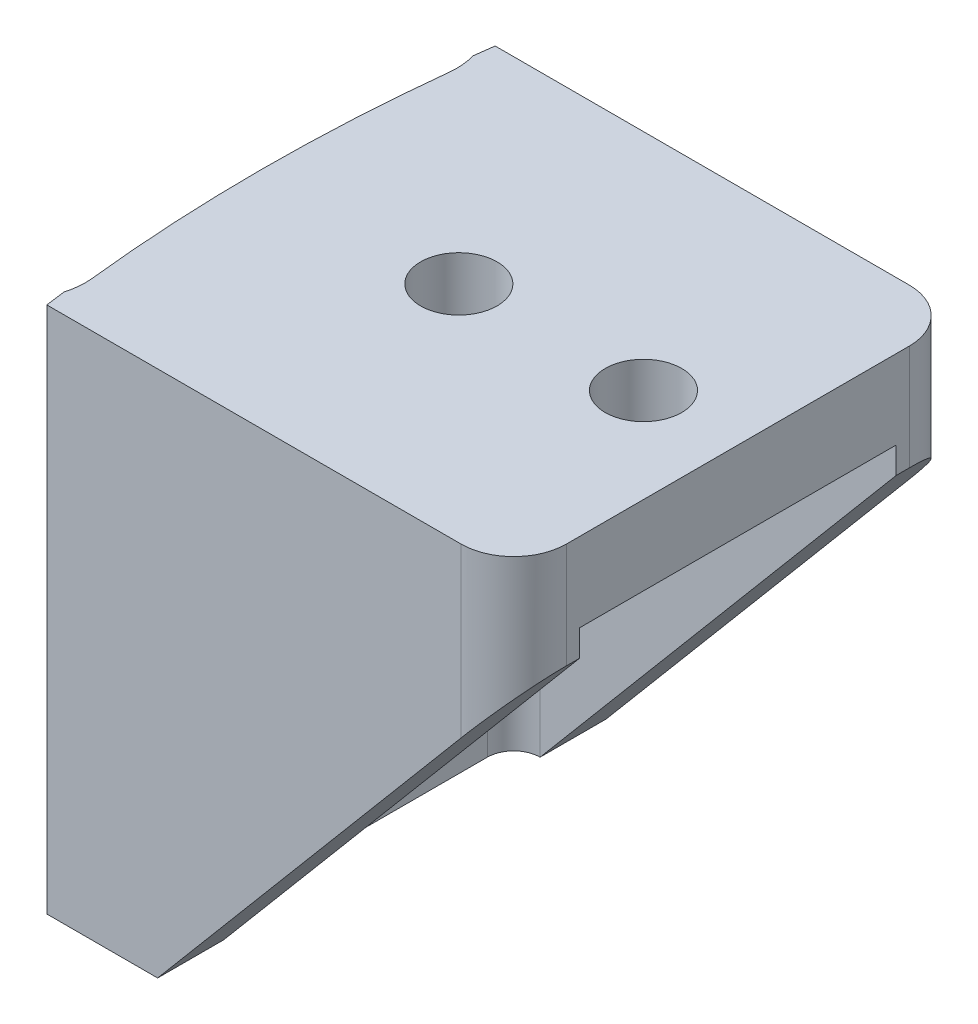
from build123d import *

# Parameters (mm, degrees)
BOSS_EXTRUDE1_DEPTH = 40
CUT_EXTRUDE1_REACH  = 137.577
SKETCH3_W           = 29
SKETCH3_H           = 24
CUT_EXTRUDE2_DEPTH  = 34
SKETCH6_R           = 2.9
CUT_EXTRUDE3_DEPTH  = 31
FILLET2_R           = 4
BOSS_EXTRUDE3_START = -40
BOSS_EXTRUDE3_DEPTH = 40
FILLET4_R           = 5
FILLET5_R           = 2


with BuildPart() as part:
    # Sketch1 → Boss-Extrude1 (new body)
    with BuildSketch(Plane(origin=(0, 0, 0), x_dir=(1, 0, 0), z_dir=(0, 1, 0))):
        with BuildLine():
            Line((-123.838604643, 17), (-88.838604643, 17))
            Line((-88.838604643, 17), (-88.838604643, -17))
            Line((-88.838604643, -17), (-123.838604643, -17))
            ThreePointArc((-123.838604643, -17), (-125, 0), (-123.838604643, 17))
        make_face()
    extrude(amount=BOSS_EXTRUDE1_DEPTH)

    # Sketch2 → Cut-Extrude1 (cut, up to next)
    with BuildSketch(Plane.XY.offset(17), mode=Mode.PRIVATE) as cut_extrude1_sk1:
        Polygon((-88.838604643, 0), (-88.838604643, 32), (-115.838604643, 0), align=None)
    cut_extrude1_tool1 = extrude(cut_extrude1_sk1.sketch, amount=-CUT_EXTRUDE1_REACH, mode=Mode.PRIVATE) & part.part
    add(cut_extrude1_tool1.solids().sort_by_distance((-97.838605, 10.666667, 17))[0], mode=Mode.SUBTRACT)

    # Sketch3 → Cut-Extrude2 (cut)
    with BuildSketch(Plane.XZ):
        with Locations((-103.338604643, 0)):
            Rectangle(SKETCH3_W, SKETCH3_H)
    extrude(amount=-CUT_EXTRUDE2_DEPTH, mode=Mode.SUBTRACT)

    # Sketch6 → Cut-Extrude3 (cut)
    with BuildSketch(Plane(origin=(0, 40, 0), x_dir=(1, 0, 0), z_dir=(0, 1, 0))):
        with Locations(Location((-110, 0, 0), (0, 0, 270))):
            Circle(SKETCH6_R)
        with Locations(Location((-96, 0, 0), (0, 0, 270))):
            Circle(SKETCH6_R)
    extrude(amount=-CUT_EXTRUDE3_DEPTH, mode=Mode.SUBTRACT)

    # Fillet2
    fillet2_edges = [part.edges().sort_by_distance(p)[0] for p in [
        (-88.838604643, 36, -17),
        (-88.838604643, 36, 17),
    ]]
    fillet(fillet2_edges, radius=FILLET2_R)

    # Sketch8 → Boss-Extrude3 (add)
    with BuildSketch(Plane(origin=(0, 40, 0), x_dir=(1, 0, 0), z_dir=(0, 1, 0)).offset(BOSS_EXTRUDE3_START)):
        with BuildLine():
            Line((-123.838604643, 17), (-124.242343829, 17))
            ThreePointArc((-124.242343829, 17), (-124.342622992, 16.250295609), (-124.438378324, 15.5))
            Line((-124.438378324, 15.5), (-124.03527724, 15.5))
            ThreePointArc((-124.03527724, 15.5), (-123.93921022, 16.250297537), (-123.838604643, 17))
        make_face()
        with BuildLine():
            Line((-124.438378324, -15.5), (-124.03527724, -15.5))
            ThreePointArc((-124.03527724, -15.5), (-123.93921022, -16.250297537), (-123.838604643, -17))
            Line((-123.838604643, -17), (-124.242343829, -17))
            ThreePointArc((-124.242343829, -17), (-124.342622992, -16.250295609), (-124.438378324, -15.5))
        make_face()
    extrude(amount=BOSS_EXTRUDE3_DEPTH)

    # Fillet4
    # the kernel refuses this fillet: 5 mm, written as the material it adds along each edge
    with BuildSketch(Plane(origin=(-124.03527724, 0, 15.5), x_dir=(-0.11618374288163974, 0, -0.9932277371731083), z_dir=(0, 1, 0))) as fillet4_piece_1:
        with BuildLine():
            CenterArc((2.007660221, 4.99984503), FILLET4_R, 246.910702944, 22.638192563)
            Line((0.046833793, 0.400371178), (0.007617264, 0.308381701))
            ThreePointArc((0.007617264, 0.308381701), (-0.075905877, 0.211803963), (-0.099322774, 0.011618374))
            Line((-0.099322774, 0.011618374), (0.000787318, -0.099996901))
            ThreePointArc((0.000787318, -0.099996901), (0.984147167, -0.096125757), (1.967507016, -0.099996901))
            Line((1.967507016, -0.099996901), (1.968294334, 0))
        make_face()
    extrude(amount=40)
    with BuildSketch(Plane(origin=(-124.03527724, 0, -15.5), x_dir=(-1, 0, 0), z_dir=(0, 1, 0))) as fillet4_piece_2:
        with BuildLine():
            CenterArc((5.199242245, 1.413163109), FILLET4_R, 173.779198266, 22.638192563)
            Line((0.228683803, 1.954964528), (0.129272634, 1.965800556))
            ThreePointArc((0.129272634, 1.965800556), (0.018867133, 0.988650514), (-0.099228222, 0.0124))
            Line((-0.099228222, 0.0124), (0, -0.1))
            ThreePointArc((0, -0.1), (0.201550542, -0.1), (0.307178261, -0.028263262))
            Line((0.307178261, -0.028263262), (0.403101084, 0))
        make_face()
    extrude(amount=40)

    # Fillet5
    fillet5_edges = [part.edges().sort_by_distance(p)[0] for p in [
        (-117.838604643, 17, 12),
        (-117.838604643, 17, -12),
    ]]
    fillet(fillet5_edges, radius=FILLET5_R)


solid = part.part
